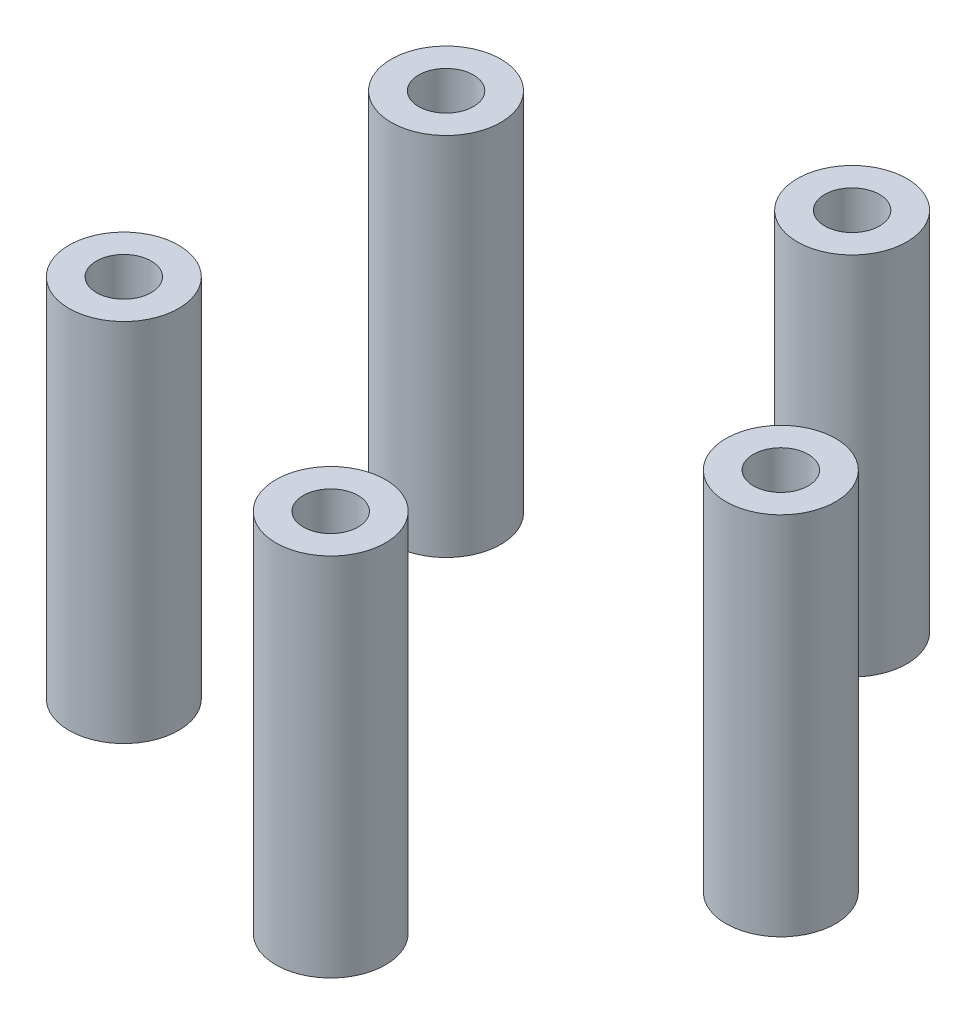
from build123d import *

# Parameters (mm, degrees)
BOSS_EXTRUDE1_DEPTH        = 12
BOSS_EXTRUDE1_DEPTH_BACK   = 8
SKETCH1_R                  = 3
SKETCH1_R_2                = 1.5
BOSS_EXTRUDE1_2_DEPTH      = 12
BOSS_EXTRUDE1_2_DEPTH_BACK = 8
BOSS_EXTRUDE1_3_DEPTH      = 12
BOSS_EXTRUDE1_3_DEPTH_BACK = 8
BOSS_EXTRUDE1_4_DEPTH      = 12
BOSS_EXTRUDE1_4_DEPTH_BACK = 8
BOSS_EXTRUDE1_5_DEPTH      = 12
BOSS_EXTRUDE1_5_DEPTH_BACK = 8


with BuildPart() as part:
    # Sketch1 → Boss-Extrude1 (new, two sides: drawn at the far end of the back side and taken through both)
    with BuildSketch(Plane(origin=(0, 0, 0), x_dir=(1, 0, 0), z_dir=(0, 1, 0)).offset(-BOSS_EXTRUDE1_DEPTH_BACK)):
        with Locations((4.035254916, 14.265847744)):
            Circle(SKETCH1_R)
        with Locations((4.035254916, 14.265847744)):
            Circle(SKETCH1_R_2, mode=Mode.SUBTRACT)
    extrude(amount=BOSS_EXTRUDE1_DEPTH + BOSS_EXTRUDE1_DEPTH_BACK)


with BuildPart() as body_2:
    # Sketch1 → Boss-Extrude1 2 (new, two sides: drawn at the far end of the back side and taken through both)
    with BuildSketch(Plane(origin=(0, 0, 0), x_dir=(1, 0, 0), z_dir=(0, 1, 0)).offset(-BOSS_EXTRUDE1_2_DEPTH_BACK)):
        with Locations((14.4, 0)):
            Circle(SKETCH1_R)
        with Locations((14.4, 0)):
            Circle(SKETCH1_R_2, mode=Mode.SUBTRACT)
    extrude(amount=BOSS_EXTRUDE1_2_DEPTH + BOSS_EXTRUDE1_2_DEPTH_BACK)


with BuildPart() as body_3:
    # Sketch1 → Boss-Extrude1 3 (new, two sides: drawn at the far end of the back side and taken through both)
    with BuildSketch(Plane(origin=(0, 0, 0), x_dir=(1, 0, 0), z_dir=(0, 1, 0)).offset(-BOSS_EXTRUDE1_3_DEPTH_BACK)):
        with Locations((4.035254916, -14.265847744)):
            Circle(SKETCH1_R)
        with Locations((4.035254916, -14.265847744)):
            Circle(SKETCH1_R_2, mode=Mode.SUBTRACT)
    extrude(amount=BOSS_EXTRUDE1_3_DEPTH + BOSS_EXTRUDE1_3_DEPTH_BACK)


with BuildPart() as body_4:
    # Sketch1 → Boss-Extrude1 4 (new, two sides: drawn at the far end of the back side and taken through both)
    with BuildSketch(Plane(origin=(0, 0, 0), x_dir=(1, 0, 0), z_dir=(0, 1, 0)).offset(-BOSS_EXTRUDE1_4_DEPTH_BACK)):
        with Locations((-12.735254916, -8.816778784)):
            Circle(SKETCH1_R)
        with Locations((-12.735254916, -8.816778784)):
            Circle(SKETCH1_R_2, mode=Mode.SUBTRACT)
    extrude(amount=BOSS_EXTRUDE1_4_DEPTH + BOSS_EXTRUDE1_4_DEPTH_BACK)


with BuildPart() as body_5:
    # Sketch1 → Boss-Extrude1 5 (new, two sides: drawn at the far end of the back side and taken through both)
    with BuildSketch(Plane(origin=(0, 0, 0), x_dir=(1, 0, 0), z_dir=(0, 1, 0)).offset(-BOSS_EXTRUDE1_5_DEPTH_BACK)):
        with Locations((-12.735254916, 8.816778784)):
            Circle(SKETCH1_R)
        with Locations((-12.735254916, 8.816778784)):
            Circle(SKETCH1_R_2, mode=Mode.SUBTRACT)
    extrude(amount=BOSS_EXTRUDE1_5_DEPTH + BOSS_EXTRUDE1_5_DEPTH_BACK)


solid = Compound([part.part, body_2.part, body_3.part, body_4.part, body_5.part])
